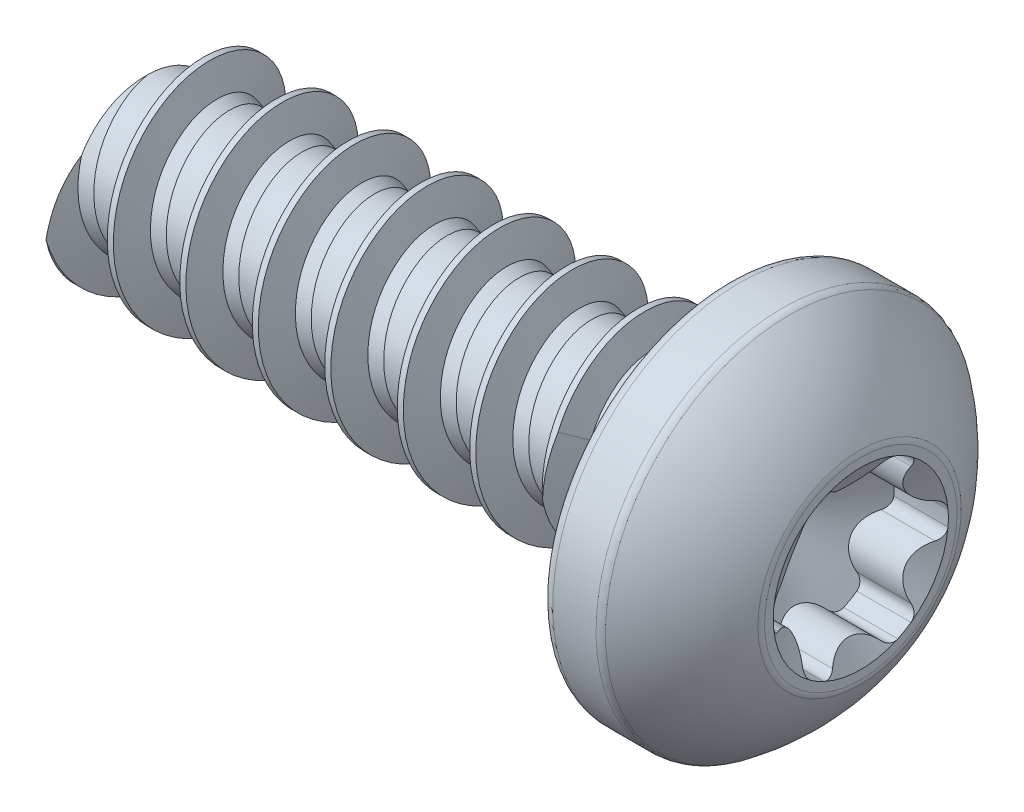
from build123d import *

# Parameters (mm, degrees)
BOSS_EXTRUDE1_REACH = 18.657
SKETCH3_R           = 2.10947
SKETCH9_W           = 11.1125
SKETCH9_H           = 2.2733
CUT_SWEEP1_PITCH    = 1.5875


# Read off the part's stored shape, not the designer's step: Split1
with BuildPart() as part:
    # Sketch2 → Revolve1 (revolve)
    with BuildSketch(Plane.XY):
        with BuildLine():
            Line((-7.8105, 0), (7.8105, 0))
            Line((7.8105, 0), (7.8105, 2.10947))
            ThreePointArc((7.8105, 2.10947), (7.803543203, 2.169547846), (7.783041005, 2.226446039))
            ThreePointArc((7.783041005, 2.226446039), (7.128324009, 3.2242883), (6.25592736, 4.038700733))
            ThreePointArc((6.25592736, 4.038700733), (6.18236426, 4.076403951), (6.100729921, 4.0894))
            Line((6.100729921, 4.0894), (5.15239, 4.0894))
            ThreePointArc((5.15239, 4.0894), (4.966498698, 4.012401302), (4.8895, 3.82651))
            Line((4.8895, 3.82651), (4.8895, 2.146882083))
            ThreePointArc((4.8895, 2.146882083), (4.735502603, 1.77509948), (4.36372, 1.621102083))
            Line((4.36372, 1.621102083), (3.548859611, 1.621102083))
            Line((3.548859611, 1.621102083), (3.302, 1.55495625))
            Line((3.302, 1.55495625), (-7.8105, 1.55495625))
            Line((-7.8105, 1.55495625), (-7.8105, 0))
        make_face()
    revolve(axis=Axis((-7.8105, 0, 0), (-1, 0, 0)))

    # Sketch12 → Cut-Revolve3 (revolve, cut)
    with BuildSketch(Plane.XY, mode=Mode.PRIVATE) as cut_revolve3_sk:
        Polygon((7.8105, 1.9177), (6.62384375, 1.9177), (5.516659139, 0), (7.8105, 0), align=None)
    revolve(cut_revolve3_sk.sketch.rotate(Axis((-7.8105, 0, 0), (1, 0, 0)), 90), axis=Axis((-7.8105, 0, 0), (1, 0, 0)), mode=Mode.SUBTRACT)

    # Boss-Extrude1: up to this cone (the profile starts inside it)
    boss_extrude1_end = Plane(origin=(7.8105, 0, 0), z_dir=(1, 0, 0)).offset(-2.293839861) * Cone(1.732e-06, 44.03546882, 25.423888777, align=(Align.CENTER, Align.CENTER, Align.MIN), mode=Mode.PRIVATE)
    # Sketch3 → Boss-Extrude1 (add, up to the surface)
    with BuildSketch(Plane(origin=(7.8105, 0, 0), x_dir=(0, 0, -1), z_dir=(1, 0, 0)), mode=Mode.PRIVATE) as boss_extrude1_sk1:
        Circle(SKETCH3_R)
        with BuildLine():
            ThreePointArc((0.95885, 1.660776917), (0.885495316, 1.701020675), (0.810455041, 1.738026443))
            ThreePointArc((0.810455041, 1.738026443), (0.659573988, 1.755303486), (0.528590549, 1.678446952))
            ThreePointArc((0.528590549, 1.678446952), (0, 1.438275), (-0.528590549, 1.678446952))
            ThreePointArc((-0.528590549, 1.678446952), (-0.659573988, 1.755303486), (-0.810455041, 1.738026443))
            ThreePointArc((-0.810455041, 1.738026443), (-0.885495316, 1.701020675), (-0.95885, 1.660776917))
            ThreePointArc((-0.95885, 1.660776917), (-1.030379459, 1.617371776), (-1.099947532, 1.570887875))
            ThreePointArc((-1.099947532, 1.570887875), (-1.190350416, 1.448859573), (-1.189282425, 1.29699632))
            ThreePointArc((-1.189282425, 1.29699632), (-1.245582688, 0.7191375), (-1.717872974, 0.381450632))
            ThreePointArc((-1.717872974, 0.381450632), (-1.849924404, 0.306443913), (-1.910402573, 0.167138568))
            ThreePointArc((-1.910402573, 0.167138568), (-1.915874775, 0.083648899), (-1.9177, 0))
            ThreePointArc((-1.9177, 0), (-1.915874775, -0.083648899), (-1.910402573, -0.167138568))
            ThreePointArc((-1.910402573, -0.167138568), (-1.849924404, -0.306443913), (-1.717872974, -0.381450632))
            ThreePointArc((-1.717872974, -0.381450632), (-1.245582688, -0.7191375), (-1.189282425, -1.29699632))
            ThreePointArc((-1.189282425, -1.29699632), (-1.190350416, -1.448859573), (-1.099947532, -1.570887875))
            ThreePointArc((-1.099947532, -1.570887875), (-1.030379459, -1.617371776), (-0.95885, -1.660776917))
            ThreePointArc((-0.95885, -1.660776917), (-0.885495316, -1.701020675), (-0.810455041, -1.738026443))
            ThreePointArc((-0.810455041, -1.738026443), (-0.659573988, -1.755303486), (-0.528590549, -1.678446952))
            ThreePointArc((-0.528590549, -1.678446952), (0, -1.438275), (0.528590549, -1.678446952))
            ThreePointArc((0.528590549, -1.678446952), (0.659573988, -1.755303486), (0.810455041, -1.738026443))
            ThreePointArc((0.810455041, -1.738026443), (0.885495316, -1.701020675), (0.95885, -1.660776917))
            ThreePointArc((0.95885, -1.660776917), (1.030379459, -1.617371776), (1.099947532, -1.570887875))
            ThreePointArc((1.099947532, -1.570887875), (1.190350416, -1.448859573), (1.189282425, -1.29699632))
            ThreePointArc((1.189282425, -1.29699632), (1.245582688, -0.7191375), (1.717872974, -0.381450632))
            ThreePointArc((1.717872974, -0.381450632), (1.849924404, -0.306443913), (1.910402573, -0.167138568))
            ThreePointArc((1.910402573, -0.167138568), (1.915874775, -0.083648899), (1.9177, 0))
            ThreePointArc((1.9177, 0), (1.915874775, 0.083648899), (1.910402573, 0.167138568))
            ThreePointArc((1.910402573, 0.167138568), (1.849924404, 0.306443913), (1.717872974, 0.381450632))
            ThreePointArc((1.717872974, 0.381450632), (1.245582688, 0.7191375), (1.189282425, 1.29699632))
            ThreePointArc((1.189282425, 1.29699632), (1.190350416, 1.448859573), (1.099947532, 1.570887875))
            ThreePointArc((1.099947532, 1.570887875), (1.030379459, 1.617371776), (0.95885, 1.660776917))
        make_face(mode=Mode.SUBTRACT)
    boss_extrude1_tool1 = extrude(boss_extrude1_sk1.sketch, amount=-BOSS_EXTRUDE1_REACH, mode=Mode.PRIVATE) & boss_extrude1_end
    add(boss_extrude1_tool1.solids().sort_by_distance((7.8105, 0, 2.049805))[0])

    # Cut-Extrude2 cone 1 section (through the dimple's axis) → Cut-Extrude2 (revolve, cut)
    with BuildSketch(Plane(origin=(7.8105, 0, 0), x_dir=(0, 0, -1), z_dir=(0, 1, 0))):
        Polygon((0, 0), (1.9177, 0), (0, 1.107184611), align=None)
    revolve(axis=Axis((7.8105, 0, 0), (-1, 0, 0)), mode=Mode.SUBTRACT)

    # Split1 outline → Split1 (revolve, cut)
    with BuildSketch(Plane.YX):
        Polygon((1.55495625, -7.8105), (1.55495625, 3.302), (0, -2.501175729), (0, -7.8105), align=None)
    revolve(axis=Axis((0, 0, 0), (1, 0, 0)), mode=Mode.SUBTRACT)


with BuildPart() as body_2:
    # Split1 2 outline → Split1 2 (revolve)
    with BuildSketch(Plane.YX):
        Polygon((1.55495625, -7.8105), (1.55495625, 3.302), (0, -2.501175729), (0, -7.8105), align=None)
    revolve(axis=Axis((0, 0, 0), (1, 0, 0)))

    # Sketch9 → Revolve2 (revolve)
    with BuildSketch(Plane.XY):
        with Locations((-2.25425, 1.13665)):
            Rectangle(SKETCH9_W, SKETCH9_H)
    revolve(axis=Axis((-7.8105, 0, 0), (1, 0, 0)))

    # Cut-Sweep1: the profile of Sketch7 screwed along a right-hand helix of 9 turns, 8 arcs to a turn; built about Z, then put on its axis
    cut_sweep1_z = Axis((0, 0, 0), (0, 0, 1))
    cut_sweep1_corners = [(2.2733, 0, -0.580100541), (1.628663455, 0, -0.752830383), (1.55495625, 0, -1.027909415), (1.55495625, 0, -1.5875), (1.628663455, 0, -1.862579032), (2.2733, 0, -2.035308874), (2.445151916, 0, -2.035308874), (2.445151916, 0, -0.580100541)]
    with BuildLine(mode=Mode.PRIVATE) as cut_sweep1_profile:
        Line(cut_sweep1_corners[0], cut_sweep1_corners[1])
        Line(cut_sweep1_corners[1], cut_sweep1_corners[2])
        Line(cut_sweep1_corners[2], cut_sweep1_corners[3])
        Line(cut_sweep1_corners[3], cut_sweep1_corners[4])
        Line(cut_sweep1_corners[4], cut_sweep1_corners[5])
        Line(cut_sweep1_corners[5], cut_sweep1_corners[6])
        Line(cut_sweep1_corners[6], cut_sweep1_corners[7])
        Line(cut_sweep1_corners[7], cut_sweep1_corners[0])
    cut_sweep1_cap = Face(cut_sweep1_profile.wire())
    cut_sweep1_turn_angles = [0, 22.5, 45, 67.5, 90, 112.5, 135, 157.5, 180, 202.5, 225, 247.5, 270, 292.5, 315, 337.5, 360]
    cut_sweep1_turn_weights = [1, 0.9238795325112867, 1, 0.9238795325112867, 1, 0.9238795325112867, 1, 0.9238795325112867, 1, 0.9238795325112867, 1, 0.9238795325112867, 1, 0.9238795325112867, 1, 0.9238795325112867, 1]
    cut_sweep1_turn_rails = [Edge.make_bspline([Vector(p[0], p[1], 0).rotate(cut_sweep1_z, cut_sweep1_turn_angles[k]) / cut_sweep1_turn_weights[k] + Vector(0, 0, p[2] + CUT_SWEEP1_PITCH * cut_sweep1_turn_angles[k] / 360) for k in range(17)], [0, 0, 0, 1, 1, 2, 2, 3, 3, 4, 4, 5, 5, 6, 6, 7, 7, 8, 8, 8], 2, cut_sweep1_turn_weights) for p in cut_sweep1_corners]
    cut_sweep1_turn_sides = [Face.make_surface_from_curves(cut_sweep1_turn_rails[p[0]], cut_sweep1_turn_rails[p[1]]) for p in [(0, 1), (1, 2), (2, 3), (3, 4), (4, 5), (5, 6), (6, 7), (7, 0)]]
    cut_sweep1 = Plane(origin=(-7.8105, 0, 0), x_dir=(0, 1, 0), z_dir=(1, 0, 0)) * Solid(Shell([*[p.moved(Location((0, 0, CUT_SWEEP1_PITCH * i))) for i in range(9) for p in cut_sweep1_turn_sides], cut_sweep1_cap, cut_sweep1_cap.rotate(cut_sweep1_z, 3240).moved(Location((0, 0, CUT_SWEEP1_PITCH * 3240 / 360)))]))
    add(cut_sweep1, mode=Mode.SUBTRACT)

    # Sketch11 → Cut-Revolve2 (revolve, cut)
    with BuildSketch(Plane.XY):
        Polygon((3.302, 1.55495625), (3.109520372, 2.2733), (3.302, 2.2733), align=None)
    revolve(axis=Axis((-7.8105, 0, 0), (1, 0, 0)), mode=Mode.SUBTRACT)

    # Combine1: union part
    add(part.part)


solid = body_2.part
